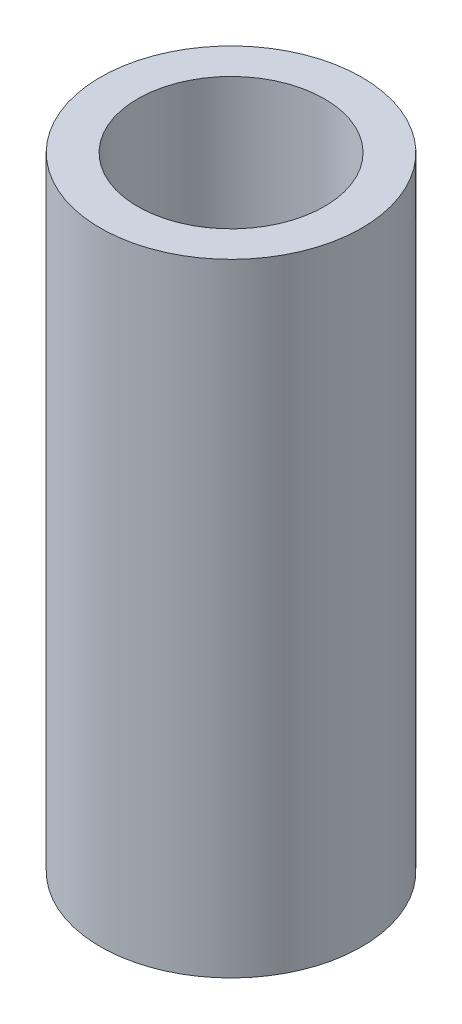
from build123d import *

# Parameters (mm, degrees)
SKETCH1_W = 0.6
SKETCH1_H = 10


with BuildPart() as part:
    # Sketch1 → Revolve1 (revolve)
    with BuildSketch(Plane.XY):
        with Locations((-1.8, 5)):
            Rectangle(SKETCH1_W, SKETCH1_H)
    revolve(axis=Axis((0, 0, 0), (0, 1, 0)))


solid = part.part
